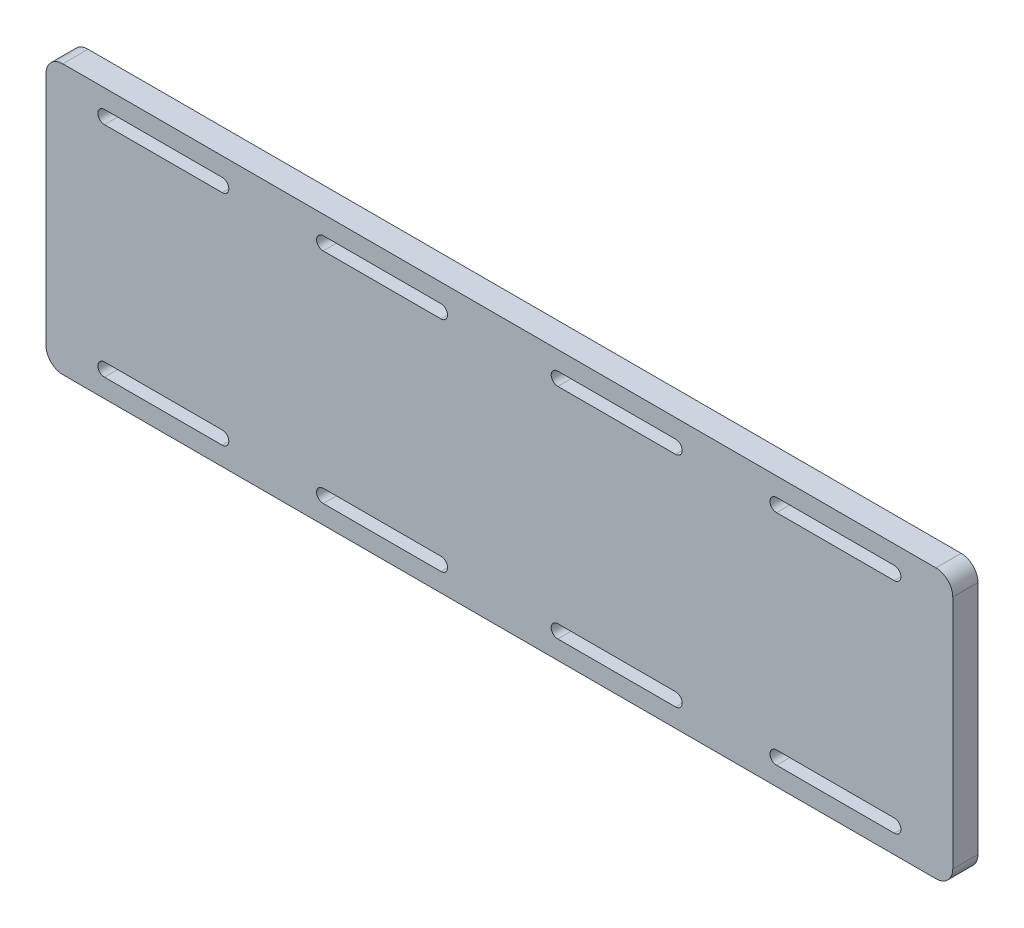
from build123d import *

# Parameters (mm, degrees)
SKETCH1_W                  = 342.1888
SKETCH1_H                  = 101.6
BOSS_EXTRUDE1_DEPTH        = 9.525
F_10_CLEARANCE_SLOT1_DEPTH = 9.525
FILLET1_R                  = 6.35


# Read off the part's stored shape, not the designer's step: #10 Clearance Slot1
with BuildPart() as part:
    # Sketch1 → Boss-Extrude1 (new body)
    with BuildSketch(Plane.XY):
        Rectangle(SKETCH1_W, SKETCH1_H)
    extrude(amount=BOSS_EXTRUDE1_DEPTH)

    # #10 Clearance Slot1 outline → #10 Clearance Slot1 (cut)
    with BuildSketch(Plane.XY):
        with BuildLine():
            Line((-149.0472, 38.7858), (-104.5972, 38.7858))
            ThreePointArc((-104.5972, 38.7858), (-102.108, 41.275), (-104.5972, 43.7642))
            Line((-104.5972, 43.7642), (-149.0472, 43.7642))
            ThreePointArc((-149.0472, 43.7642), (-151.5364, 41.275), (-149.0472, 38.7858))
        make_face()
        with BuildLine():
            ThreePointArc((-22.0472, 38.7858), (-19.558, 41.275), (-22.0472, 43.7642))
            Line((-22.0472, 43.7642), (-66.4972, 43.7642))
            ThreePointArc((-66.4972, 43.7642), (-68.9864, 41.275), (-66.4972, 38.7858))
            Line((-66.4972, 38.7858), (-22.0472, 38.7858))
        make_face()
        with BuildLine():
            ThreePointArc((66.4972, 38.7858), (68.9864, 41.275), (66.4972, 43.7642))
            Line((66.4972, 43.7642), (22.0472, 43.7642))
            ThreePointArc((22.0472, 43.7642), (19.558, 41.275), (22.0472, 38.7858))
            Line((22.0472, 38.7858), (66.4972, 38.7858))
        make_face()
        with BuildLine():
            ThreePointArc((149.0472, 38.7858), (151.5364, 41.275), (149.0472, 43.7642))
            Line((149.0472, 43.7642), (104.5972, 43.7642))
            ThreePointArc((104.5972, 43.7642), (102.108, 41.275), (104.5972, 38.7858))
            Line((104.5972, 38.7858), (149.0472, 38.7858))
        make_face()
        with BuildLine():
            Line((104.5972, -43.7642), (149.0472, -43.7642))
            ThreePointArc((149.0472, -43.7642), (151.5364, -41.275), (149.0472, -38.7858))
            Line((149.0472, -38.7858), (104.5972, -38.7858))
            ThreePointArc((104.5972, -38.7858), (102.108, -41.275), (104.5972, -43.7642))
        make_face()
        with BuildLine():
            ThreePointArc((66.4972, -43.7642), (68.9864, -41.275), (66.4972, -38.7858))
            Line((66.4972, -38.7858), (22.0472, -38.7858))
            ThreePointArc((22.0472, -38.7858), (19.558, -41.275), (22.0472, -43.7642))
            Line((22.0472, -43.7642), (66.4972, -43.7642))
        make_face()
        with BuildLine():
            ThreePointArc((-22.0472, -43.7642), (-19.558, -41.275), (-22.0472, -38.7858))
            Line((-22.0472, -38.7858), (-66.4972, -38.7858))
            ThreePointArc((-66.4972, -38.7858), (-68.9864, -41.275), (-66.4972, -43.7642))
            Line((-66.4972, -43.7642), (-22.0472, -43.7642))
        make_face()
        with BuildLine():
            ThreePointArc((-104.5972, -43.7642), (-102.108, -41.275), (-104.5972, -38.7858))
            Line((-104.5972, -38.7858), (-149.0472, -38.7858))
            ThreePointArc((-149.0472, -38.7858), (-151.5364, -41.275), (-149.0472, -43.7642))
            Line((-149.0472, -43.7642), (-104.5972, -43.7642))
        make_face()
    extrude(amount=F_10_CLEARANCE_SLOT1_DEPTH, mode=Mode.SUBTRACT)

    # Fillet1
    fillet1_edges = [part.edges().sort_by_distance(p)[0] for p in [
        (-171.0944, 50.8, 4.7625),
        (171.0944, 50.8, 4.7625),
        (171.0944, -50.8, 4.7625),
        (-171.0944, -50.8, 4.7625),
    ]]
    fillet(fillet1_edges, radius=FILLET1_R)


solid = part.part
